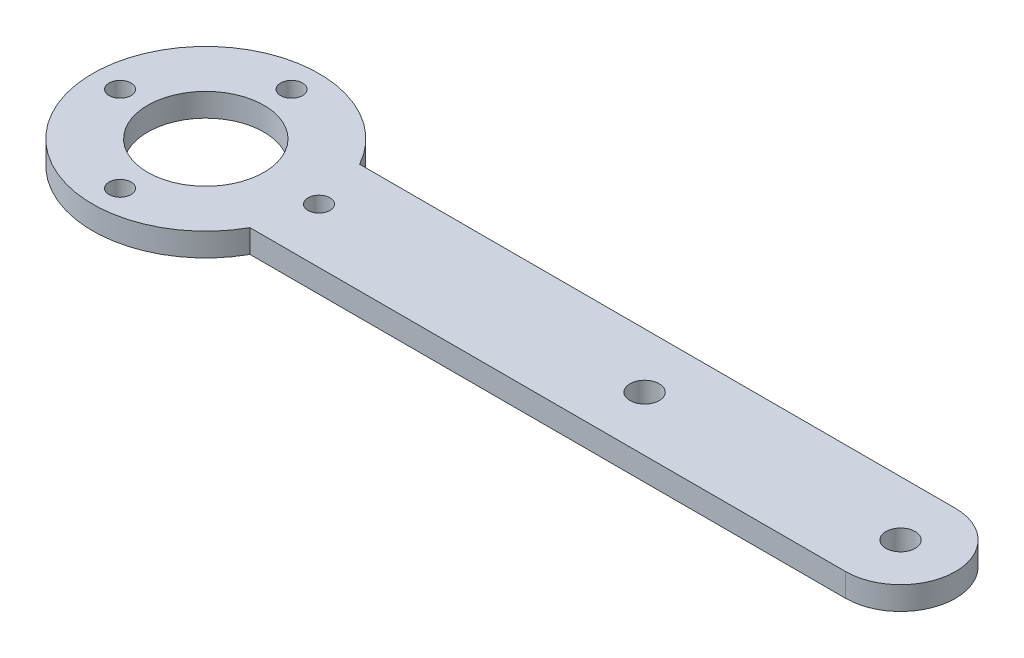
from build123d import *

# Parameters (mm, degrees)
SKETCH1_R           = 7.95
SKETCH1_R_2         = 1.5
SKETCH1_R_3         = 2
BOSS_EXTRUDE1_DEPTH = 3.175


with BuildPart() as part:
    # Sketch1 → Boss-Extrude1 (new body)
    with BuildSketch(Plane(origin=(0, 0, 0), x_dir=(1, 0, 0), z_dir=(0, 1, 0))):
        with BuildLine():
            Line((13.53608603, 7.5), (95, 7.5))
            ThreePointArc((95, 7.5), (102.5, 0), (95, -7.5))
            Line((95, -7.5), (13.53608603, -7.5))
            ThreePointArc((13.53608603, -7.5), (-15.475, 0), (13.53608603, 7.5))
        make_face()
        Circle(SKETCH1_R, mode=Mode.SUBTRACT)
        with Locations((0, -11.725)):
            Circle(SKETCH1_R_2, mode=Mode.SUBTRACT)
        with Locations((0, 11.725)):
            Circle(SKETCH1_R_2, mode=Mode.SUBTRACT)
        with Locations((-11.725, 0)):
            Circle(SKETCH1_R_2, mode=Mode.SUBTRACT)
        with Locations((15.475, 0)):
            Circle(SKETCH1_R_2, mode=Mode.SUBTRACT)
        with Locations((95, 0)):
            Circle(SKETCH1_R_3, mode=Mode.SUBTRACT)
        with Locations((60, 0)):
            Circle(SKETCH1_R_3, mode=Mode.SUBTRACT)
    extrude(amount=BOSS_EXTRUDE1_DEPTH)


solid = part.part
